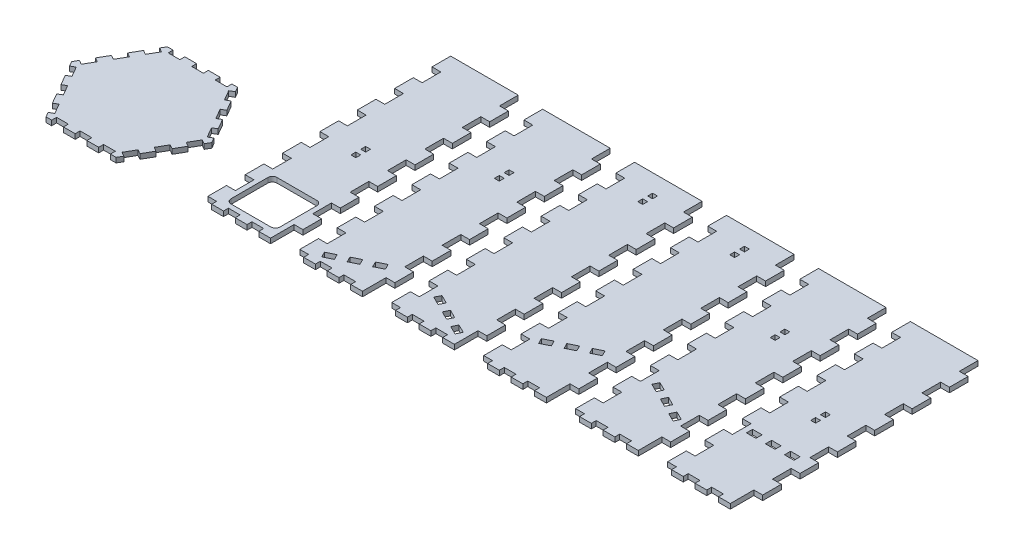
from build123d import *

# Parameters (mm, degrees)
BOSS_EXTRUDE3_DEPTH   = 3.2
SKETCH1_W             = 3.2
SKETCH1_H             = 3.2
BOSS_EXTRUDE3_2_DEPTH = 3.2
BOSS_EXTRUDE3_3_DEPTH = 3.2
BOSS_EXTRUDE3_4_DEPTH = 3.2
BOSS_EXTRUDE3_5_DEPTH = 3.2
BOSS_EXTRUDE3_6_DEPTH = 3.2
SKETCH1_W_2           = 6.2
SKETCH1_H_2           = 4
BOSS_EXTRUDE3_7_DEPTH = 3.2


with BuildPart() as part:
    # Sketch1 → Boss-Extrude3 (new body)
    with BuildSketch(Plane(origin=(0, 0, 0), x_dir=(1, 0, 0), z_dir=(0, 1, 0))):
        Polygon((-22.869998863, -39.612), (-19.17495714, -39.612), (-19.17495714, -36.412), (-11.504974284, -36.412), (-11.504974284, -39.612), (-3.834991428, -39.612), (-3.834991428, -36.412), (3.834991428, -36.412), (3.834991428, -39.612), (11.504974284, -39.612), (11.504974284, -36.412), (19.17495714, -36.412), (19.17495714, -39.612), (22.869998863, -39.612), (24.717519725, -36.412), (21.946238432, -34.812), (25.781229861, -28.1696), (28.552511153, -29.7696), (32.387502581, -23.1272), (29.616221289, -21.5272), (33.451212717, -14.8848), (36.222494009, -16.4848), (40.057485437, -9.8424), (37.286204145, -8.2424), (41.121195573, -1.6), (43.892476865, -3.2), (45.739997726, 0), (43.892476865, 3.2), (41.121195573, 1.6), (37.286204145, 8.2424), (40.057485437, 9.8424), (36.222494009, 16.4848), (33.451212717, 14.8848), (29.616221289, 21.5272), (32.387502581, 23.1272), (28.552511153, 29.7696), (25.781229861, 28.1696), (21.946238432, 34.812), (24.717519725, 36.412), (22.869998863, 39.612), (19.17495714, 39.612), (19.17495714, 36.412), (11.504974284, 36.412), (11.504974284, 39.612), (3.834991428, 39.612), (3.834991428, 36.412), (-3.834991428, 36.412), (-3.834991428, 39.612), (-11.504974284, 39.612), (-11.504974284, 36.412), (-19.17495714, 36.412), (-19.17495714, 39.612), (-22.869998863, 39.612), (-24.717519725, 36.412), (-21.946238432, 34.812), (-25.781229861, 28.1696), (-28.552511153, 29.7696), (-32.387502581, 23.1272), (-29.616221289, 21.5272), (-33.451212717, 14.8848), (-36.222494009, 16.4848), (-40.057485437, 9.8424), (-37.286204145, 8.2424), (-41.121195573, 1.6), (-43.892476865, 3.2), (-45.739997726, 0), (-43.892476865, -3.2), (-41.121195573, -1.6), (-37.286204145, -8.2424), (-40.057485437, -9.8424), (-36.222494009, -16.4848), (-33.451212717, -14.8848), (-29.616221289, -21.5272), (-32.387502581, -23.1272), (-28.552511153, -29.7696), (-25.781229861, -28.1696), (-21.946238432, -34.812), (-24.717519725, -36.412), align=None)
    extrude(amount=BOSS_EXTRUDE3_DEPTH)


with BuildPart() as body_2:
    # Sketch1 → Boss-Extrude3 2 (new body)
    with BuildSketch(Plane(origin=(0, 0, 0), x_dir=(1, 0, 0), z_dir=(0, 1, 0))):
        Polygon((80.552757397, -34.879378177), (88.222740254, -34.879378177), (88.222740254, -31.679378177), (95.89272311, -31.679378177), (95.89272311, -34.879378177), (103.562705966, -34.879378177), (103.562705966, -31.679378177), (111.232688822, -31.679378177), (111.232688822, -34.879378177), (118.902671678, -34.879378177), (118.902671678, -19.491070485), (124.645234262, -19.491070485), (124.645234262, -7.302762793), (118.902671678, -7.302762793), (118.902671678, 4.8855449), (124.645234262, 4.8855449), (124.645234262, 17.073852592), (118.902671678, 17.073852592), (118.902671678, 29.262160284), (124.645234262, 29.262160284), (124.645234262, 41.450467977), (118.902671678, 41.450467977), (118.902671678, 53.638775669), (124.645234262, 53.638775669), (124.645234262, 65.827083361), (118.902671678, 65.827083361), (118.902671678, 78.015391054), (124.645234262, 78.015391054), (124.645234262, 90.203698746), (118.902671678, 90.203698746), (118.902671678, 102.392006438), (124.645234262, 102.392006438), (124.645234262, 114.58031413), (118.902671678, 114.58031413), (118.902671678, 126.768621823), (74.810194813, 126.768621823), (74.810194813, 114.58031413), (80.552757397, 114.58031413), (80.552757397, 102.392006438), (74.810194813, 102.392006438), (74.810194813, 90.203698746), (80.552757397, 90.203698746), (80.552757397, 78.015391054), (74.810194813, 78.015391054), (74.810194813, 65.827083361), (80.552757397, 65.827083361), (80.552757397, 53.638775669), (74.810194813, 53.638775669), (74.810194813, 41.450467977), (80.552757397, 41.450467977), (80.552757397, 29.262160284), (74.810194813, 29.262160284), (74.810194813, 17.073852592), (80.552757397, 17.073852592), (80.552757397, 4.8855449), (74.810194813, 4.8855449), (74.810194813, -7.302762793), (80.552757397, -7.302762793), (80.552757397, -19.491070485), (74.810194813, -19.491070485), (74.810194813, -31.679378177), (80.552757397, -31.679378177), align=None)
        with BuildLine():
            Line((86.752757397, 1.520621823), (112.702671678, 1.520621823))
            ThreePointArc((112.702671678, 1.520621823), (114.823992022, 0.641942166), (115.702671678, -1.479378177))
            Line((115.702671678, -1.479378177), (115.702671678, -25.479378177))
            ThreePointArc((115.702671678, -25.479378177), (114.823992022, -27.600698521), (112.702671678, -28.479378177))
            Line((112.702671678, -28.479378177), (86.752757397, -28.479378177))
            ThreePointArc((86.752757397, -28.479378177), (84.631437054, -27.600698521), (83.752757397, -25.479378177))
            Line((83.752757397, -25.479378177), (83.752757397, -1.479378177))
            ThreePointArc((83.752757397, -1.479378177), (84.631437054, 0.641942166), (86.752757397, 1.520621823))
        make_face(mode=Mode.SUBTRACT)
        with Locations((99.727714538, 39.960621823)):
            Rectangle(SKETCH1_W, SKETCH1_H, mode=Mode.SUBTRACT)
        with Locations((99.727714538, 46.360621823)):
            Rectangle(SKETCH1_W, SKETCH1_H, mode=Mode.SUBTRACT)
    extrude(amount=BOSS_EXTRUDE3_2_DEPTH)


with BuildPart() as body_3:
    # Sketch1 → Boss-Extrude3 3 (new body)
    with BuildSketch(Plane(origin=(0, 0, 0), x_dir=(1, 0, 0), z_dir=(0, 1, 0))):
        Polygon((140.552757397, -34.879378177), (148.222740254, -34.879378177), (148.222740254, -31.679378177), (155.89272311, -31.679378177), (155.89272311, -34.879378177), (163.562705966, -34.879378177), (163.562705966, -31.679378177), (171.232688822, -31.679378177), (171.232688822, -34.879378177), (178.902671678, -34.879378177), (178.902671678, -19.491070485), (184.645234262, -19.491070485), (184.645234262, -7.302762793), (178.902671678, -7.302762793), (178.902671678, 4.8855449), (184.645234262, 4.8855449), (184.645234262, 17.073852592), (178.902671678, 17.073852592), (178.902671678, 29.262160284), (184.645234262, 29.262160284), (184.645234262, 41.450467977), (178.902671678, 41.450467977), (178.902671678, 53.638775669), (184.645234262, 53.638775669), (184.645234262, 65.827083361), (178.902671678, 65.827083361), (178.902671678, 78.015391054), (184.645234262, 78.015391054), (184.645234262, 90.203698746), (178.902671678, 90.203698746), (178.902671678, 102.392006438), (184.645234262, 102.392006438), (184.645234262, 114.58031413), (178.902671678, 114.58031413), (178.902671678, 126.768621823), (134.810194813, 126.768621823), (134.810194813, 114.58031413), (140.552757397, 114.58031413), (140.552757397, 102.392006438), (134.810194813, 102.392006438), (134.810194813, 90.203698746), (140.552757397, 90.203698746), (140.552757397, 78.015391054), (134.810194813, 78.015391054), (134.810194813, 65.827083361), (140.552757397, 65.827083361), (140.552757397, 53.638775669), (134.810194813, 53.638775669), (134.810194813, 41.450467977), (140.552757397, 41.450467977), (140.552757397, 29.262160284), (134.810194813, 29.262160284), (134.810194813, 17.073852592), (140.552757397, 17.073852592), (140.552757397, 4.8855449), (134.810194813, 4.8855449), (134.810194813, -7.302762793), (140.552757397, -7.302762793), (140.552757397, -19.491070485), (134.810194813, -19.491070485), (134.810194813, -31.679378177), (140.552757397, -31.679378177), align=None)
        Polygon((144.432637465, -25.240025921), (149.978339593, -22.467808774), (151.766866785, -26.045681115), (146.221164657, -28.817898262), align=None, mode=Mode.SUBTRACT)
        Polygon((155.524041721, -19.695591627), (161.069743848, -16.92337448), (162.85827104, -20.50124682), (157.312568912, -23.273463967), align=None, mode=Mode.SUBTRACT)
        Polygon((166.615445976, -14.151157333), (172.161148104, -11.378940185), (173.949675295, -14.956812526), (168.403973168, -17.729029673), align=None, mode=Mode.SUBTRACT)
        with Locations((159.727714538, 73.560621823)):
            Rectangle(SKETCH1_W, SKETCH1_H, mode=Mode.SUBTRACT)
        with Locations((159.727714538, 79.960621823)):
            Rectangle(SKETCH1_W, SKETCH1_H, mode=Mode.SUBTRACT)
    extrude(amount=BOSS_EXTRUDE3_3_DEPTH)


with BuildPart() as body_4:
    # Sketch1 → Boss-Extrude3 4 (new body)
    with BuildSketch(Plane(origin=(0, 0, 0), x_dir=(1, 0, 0), z_dir=(0, 1, 0))):
        Polygon((200.552757397, -34.879378177), (208.222740254, -34.879378177), (208.222740254, -31.679378177), (215.89272311, -31.679378177), (215.89272311, -34.879378177), (223.562705966, -34.879378177), (223.562705966, -31.679378177), (231.232688822, -31.679378177), (231.232688822, -34.879378177), (238.902671678, -34.879378177), (238.902671678, -19.491070485), (244.645234262, -19.491070485), (244.645234262, -7.302762793), (238.902671678, -7.302762793), (238.902671678, 4.8855449), (244.645234262, 4.8855449), (244.645234262, 17.073852592), (238.902671678, 17.073852592), (238.902671678, 29.262160284), (244.645234262, 29.262160284), (244.645234262, 41.450467977), (238.902671678, 41.450467977), (238.902671678, 53.638775669), (244.645234262, 53.638775669), (244.645234262, 65.827083361), (238.902671678, 65.827083361), (238.902671678, 78.015391054), (244.645234262, 78.015391054), (244.645234262, 90.203698746), (238.902671678, 90.203698746), (238.902671678, 102.392006438), (244.645234262, 102.392006438), (244.645234262, 114.58031413), (238.902671678, 114.58031413), (238.902671678, 126.768621823), (194.810194813, 126.768621823), (194.810194813, 114.58031413), (200.552757397, 114.58031413), (200.552757397, 102.392006438), (194.810194813, 102.392006438), (194.810194813, 90.203698746), (200.552757397, 90.203698746), (200.552757397, 78.015391054), (194.810194813, 78.015391054), (194.810194813, 65.827083361), (200.552757397, 65.827083361), (200.552757397, 53.638775669), (194.810194813, 53.638775669), (194.810194813, 41.450467977), (200.552757397, 41.450467977), (200.552757397, 29.262160284), (194.810194813, 29.262160284), (194.810194813, 17.073852592), (200.552757397, 17.073852592), (200.552757397, 4.8855449), (194.810194813, 4.8855449), (194.810194813, -7.302762793), (200.552757397, -7.302762793), (200.552757397, -19.491070485), (194.810194813, -19.491070485), (194.810194813, -31.679378177), (200.552757397, -31.679378177), align=None)
        Polygon((207.294280972, -11.378940185), (205.50575378, -14.956812526), (211.051455908, -17.729029673), (212.8399831, -14.151157333), align=None, mode=Mode.SUBTRACT)
        Polygon((218.385685227, -16.92337448), (216.597158036, -20.50124682), (222.142860163, -23.273463967), (223.931387355, -19.695591627), align=None, mode=Mode.SUBTRACT)
        Polygon((229.477089483, -22.467808774), (227.688562291, -26.045681115), (233.234264419, -28.817898262), (235.02279161, -25.240025921), align=None, mode=Mode.SUBTRACT)
        with Locations((219.727714538, 107.160621823)):
            Rectangle(SKETCH1_W, SKETCH1_H, mode=Mode.SUBTRACT)
        with Locations((219.727714538, 113.560621823)):
            Rectangle(SKETCH1_W, SKETCH1_H, mode=Mode.SUBTRACT)
    extrude(amount=BOSS_EXTRUDE3_4_DEPTH)


with BuildPart() as body_5:
    # Sketch1 → Boss-Extrude3 5 (new body)
    with BuildSketch(Plane(origin=(0, 0, 0), x_dir=(1, 0, 0), z_dir=(0, 1, 0))):
        Polygon((260.552757397, -34.879378177), (268.222740254, -34.879378177), (268.222740254, -31.679378177), (275.89272311, -31.679378177), (275.89272311, -34.879378177), (283.562705966, -34.879378177), (283.562705966, -31.679378177), (291.232688822, -31.679378177), (291.232688822, -34.879378177), (298.902671678, -34.879378177), (298.902671678, -19.491070485), (304.645234262, -19.491070485), (304.645234262, -7.302762793), (298.902671678, -7.302762793), (298.902671678, 4.8855449), (304.645234262, 4.8855449), (304.645234262, 17.073852592), (298.902671678, 17.073852592), (298.902671678, 29.262160284), (304.645234262, 29.262160284), (304.645234262, 41.450467977), (298.902671678, 41.450467977), (298.902671678, 53.638775669), (304.645234262, 53.638775669), (304.645234262, 65.827083361), (298.902671678, 65.827083361), (298.902671678, 78.015391054), (304.645234262, 78.015391054), (304.645234262, 90.203698746), (298.902671678, 90.203698746), (298.902671678, 102.392006438), (304.645234262, 102.392006438), (304.645234262, 114.58031413), (298.902671678, 114.58031413), (298.902671678, 126.768621823), (254.810194813, 126.768621823), (254.810194813, 114.58031413), (260.552757397, 114.58031413), (260.552757397, 102.392006438), (254.810194813, 102.392006438), (254.810194813, 90.203698746), (260.552757397, 90.203698746), (260.552757397, 78.015391054), (254.810194813, 78.015391054), (254.810194813, 65.827083361), (260.552757397, 65.827083361), (260.552757397, 53.638775669), (254.810194813, 53.638775669), (254.810194813, 41.450467977), (260.552757397, 41.450467977), (260.552757397, 29.262160284), (254.810194813, 29.262160284), (254.810194813, 17.073852592), (260.552757397, 17.073852592), (260.552757397, 4.8855449), (254.810194813, 4.8855449), (254.810194813, -7.302762793), (260.552757397, -7.302762793), (260.552757397, -19.491070485), (254.810194813, -19.491070485), (254.810194813, -31.679378177), (260.552757397, -31.679378177), align=None)
        Polygon((265.863459219, -6.902455299), (264.074932027, -3.324582959), (269.620634155, -0.552365811), (271.409161346, -4.130238152), align=None, mode=Mode.SUBTRACT)
        Polygon((275.166336282, 2.219851336), (276.954863474, -1.358021005), (282.500565602, 1.414196143), (280.71203841, 4.992068483), align=None, mode=Mode.SUBTRACT)
        Polygon((286.257740538, 7.76428563), (288.046267729, 4.18641329), (293.591969857, 6.958630437), (291.803442665, 10.536502777), align=None, mode=Mode.SUBTRACT)
        with Locations((279.727714538, 113.560621823)):
            Rectangle(SKETCH1_W, SKETCH1_H, mode=Mode.SUBTRACT)
        with Locations((279.727714538, 107.160621823)):
            Rectangle(SKETCH1_W, SKETCH1_H, mode=Mode.SUBTRACT)
    extrude(amount=BOSS_EXTRUDE3_5_DEPTH)


with BuildPart() as body_6:
    # Sketch1 → Boss-Extrude3 6 (new body)
    with BuildSketch(Plane(origin=(0, 0, 0), x_dir=(1, 0, 0), z_dir=(0, 1, 0))):
        Polygon((320.552757397, -34.879378177), (328.222740254, -34.879378177), (328.222740254, -31.679378177), (335.89272311, -31.679378177), (335.89272311, -34.879378177), (343.562705966, -34.879378177), (343.562705966, -31.679378177), (351.232688822, -31.679378177), (351.232688822, -34.879378177), (358.902671678, -34.879378177), (358.902671678, -19.491070485), (364.645234262, -19.491070485), (364.645234262, -7.302762793), (358.902671678, -7.302762793), (358.902671678, 4.8855449), (364.645234262, 4.8855449), (364.645234262, 17.073852592), (358.902671678, 17.073852592), (358.902671678, 29.262160284), (364.645234262, 29.262160284), (364.645234262, 41.450467977), (358.902671678, 41.450467977), (358.902671678, 53.638775669), (364.645234262, 53.638775669), (364.645234262, 65.827083361), (358.902671678, 65.827083361), (358.902671678, 78.015391054), (364.645234262, 78.015391054), (364.645234262, 90.203698746), (358.902671678, 90.203698746), (358.902671678, 102.392006438), (364.645234262, 102.392006438), (364.645234262, 114.58031413), (358.902671678, 114.58031413), (358.902671678, 126.768621823), (314.810194813, 126.768621823), (314.810194813, 114.58031413), (320.552757397, 114.58031413), (320.552757397, 102.392006438), (314.810194813, 102.392006438), (314.810194813, 90.203698746), (320.552757397, 90.203698746), (320.552757397, 78.015391054), (314.810194813, 78.015391054), (314.810194813, 65.827083361), (320.552757397, 65.827083361), (320.552757397, 53.638775669), (314.810194813, 53.638775669), (314.810194813, 41.450467977), (320.552757397, 41.450467977), (320.552757397, 29.262160284), (314.810194813, 29.262160284), (314.810194813, 17.073852592), (320.552757397, 17.073852592), (320.552757397, 4.8855449), (314.810194813, 4.8855449), (314.810194813, -7.302762793), (320.552757397, -7.302762793), (320.552757397, -19.491070485), (314.810194813, -19.491070485), (314.810194813, -31.679378177), (320.552757397, -31.679378177), align=None)
        Polygon((327.65198641, 10.536502777), (333.197688538, 7.76428563), (331.409161346, 4.18641329), (325.863459219, 6.958630437), align=None, mode=Mode.SUBTRACT)
        Polygon((338.743390666, 4.992068483), (344.289092793, 2.219851336), (342.500565602, -1.358021005), (336.954863474, 1.414196143), align=None, mode=Mode.SUBTRACT)
        Polygon((348.046267729, -4.130238152), (353.591969857, -6.902455299), (355.380497049, -3.324582959), (349.834794921, -0.552365811), align=None, mode=Mode.SUBTRACT)
        with Locations((339.727714538, 79.960621823)):
            Rectangle(SKETCH1_W, SKETCH1_H, mode=Mode.SUBTRACT)
        with Locations((339.727714538, 73.560621823)):
            Rectangle(SKETCH1_W, SKETCH1_H, mode=Mode.SUBTRACT)
    extrude(amount=BOSS_EXTRUDE3_6_DEPTH)


with BuildPart() as body_7:
    # Sketch1 → Boss-Extrude3 7 (new body)
    with BuildSketch(Plane(origin=(0, 0, 0), x_dir=(1, 0, 0), z_dir=(0, 1, 0))):
        Polygon((380.552757397, -34.879378177), (388.222740254, -34.879378177), (388.222740254, -31.679378177), (395.89272311, -31.679378177), (395.89272311, -34.879378177), (403.562705966, -34.879378177), (403.562705966, -31.679378177), (411.232688822, -31.679378177), (411.232688822, -34.879378177), (418.902671678, -34.879378177), (418.902671678, -19.491070485), (424.645234262, -19.491070485), (424.645234262, -7.302762793), (418.902671678, -7.302762793), (418.902671678, 4.8855449), (424.645234262, 4.8855449), (424.645234262, 17.073852592), (418.902671678, 17.073852592), (418.902671678, 29.262160284), (424.645234262, 29.262160284), (424.645234262, 41.450467977), (418.902671678, 41.450467977), (418.902671678, 53.638775669), (424.645234262, 53.638775669), (424.645234262, 65.827083361), (418.902671678, 65.827083361), (418.902671678, 78.015391054), (424.645234262, 78.015391054), (424.645234262, 90.203698746), (418.902671678, 90.203698746), (418.902671678, 102.392006438), (424.645234262, 102.392006438), (424.645234262, 114.58031413), (418.902671678, 114.58031413), (418.902671678, 126.768621823), (374.810194813, 126.768621823), (374.810194813, 114.58031413), (380.552757397, 114.58031413), (380.552757397, 102.392006438), (374.810194813, 102.392006438), (374.810194813, 90.203698746), (380.552757397, 90.203698746), (380.552757397, 78.015391054), (374.810194813, 78.015391054), (374.810194813, 65.827083361), (380.552757397, 65.827083361), (380.552757397, 53.638775669), (374.810194813, 53.638775669), (374.810194813, 41.450467977), (380.552757397, 41.450467977), (380.552757397, 29.262160284), (374.810194813, 29.262160284), (374.810194813, 17.073852592), (380.552757397, 17.073852592), (380.552757397, 4.8855449), (374.810194813, 4.8855449), (374.810194813, -7.302762793), (380.552757397, -7.302762793), (380.552757397, -19.491070485), (374.810194813, -19.491070485), (374.810194813, -31.679378177), (380.552757397, -31.679378177), align=None)
        with Locations((387.327714538, 12.360621823)):
            Rectangle(SKETCH1_W_2, SKETCH1_H_2, mode=Mode.SUBTRACT)
        with Locations((399.727714538, 12.360621823)):
            Rectangle(SKETCH1_W_2, SKETCH1_H_2, mode=Mode.SUBTRACT)
        with Locations((412.127714538, 12.360621823)):
            Rectangle(SKETCH1_W_2, SKETCH1_H_2, mode=Mode.SUBTRACT)
        with Locations((399.727714538, 46.360621823)):
            Rectangle(SKETCH1_W, SKETCH1_H, mode=Mode.SUBTRACT)
        with Locations((399.727714538, 39.960621823)):
            Rectangle(SKETCH1_W, SKETCH1_H, mode=Mode.SUBTRACT)
    extrude(amount=BOSS_EXTRUDE3_7_DEPTH)


solid = Compound([part.part, body_2.part, body_3.part, body_4.part, body_5.part, body_6.part, body_7.part])
